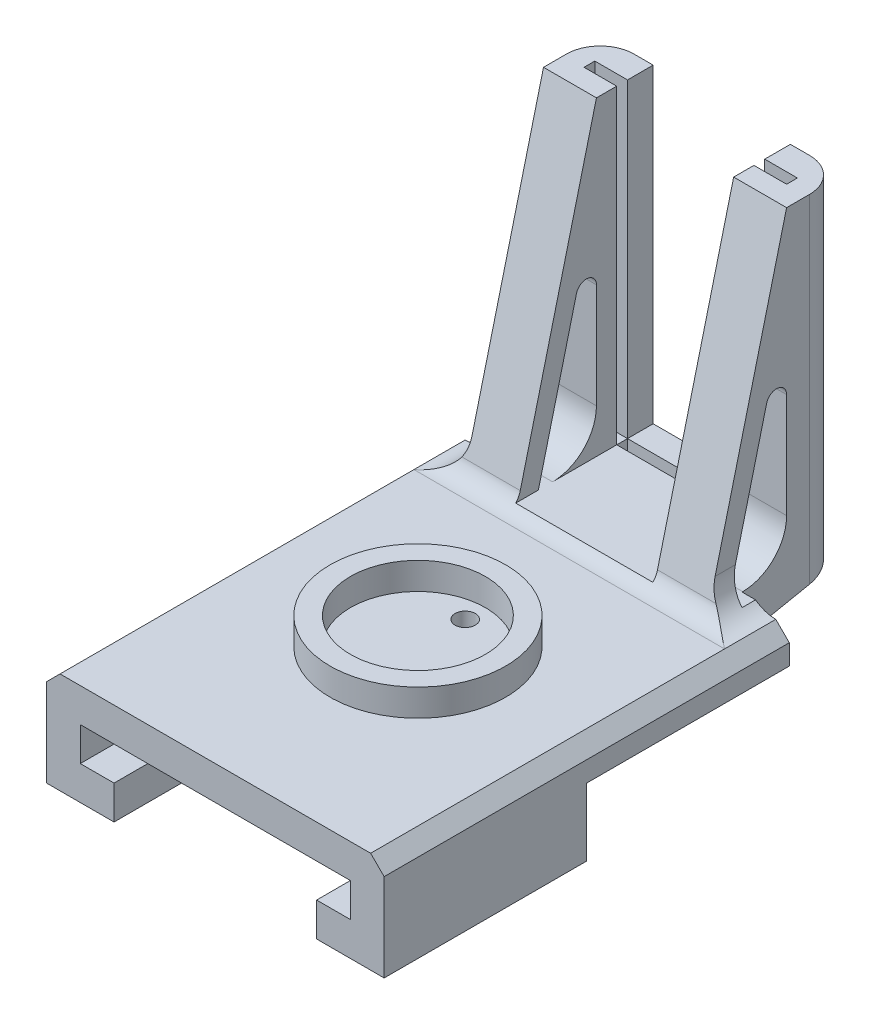
from build123d import *

# Parameters (mm, degrees)
SKETCH_2_W          = 60
SKETCH_2_H          = 60
EXTRUDE_1_DEPTH     = 3
EXTRUDE_START       = 30
EXTRUDE_3_DEPTH     = 30
EXTRUDE_START_2     = 3
SKETCH_8_W          = 36
SKETCH_8_H          = 20
EXTRUDE_4_DEPTH     = 3
CUT_EXTRUDE_START   = 6
SKETCH_10_W         = 20.32
SKETCH_10_H         = 1.6
CUT_EXTRUDE_2_DEPTH = 3
EXTRUDE_START_3     = 6
EXTRUDE_5_DEPTH     = 46
EXTRUDE_START_4     = -18
EXTRUDE_6_DEPTH     = 36
EXTRUDE_START_5     = 18
EXTRUDE_8_DEPTH     = 7.84
EXTRUDE_START_6     = -10.16
EXTRUDE_9_DEPTH     = 7.84
EXTRUDE_10_DEPTH    = 36
SKETCH_16_W         = 5
SKETCH_16_H         = 60
CUT_EXTRUDE_3_DEPTH = 3
EXTRUDE_11_DEPTH    = 4
EXTRUDE_12_DEPTH    = 4
FILLET_3_R          = 5
FILLET_4_R          = 10
SKETCH_22_W         = 50
SKETCH_22_H         = 2
EXTRUDE_14_DEPTH    = 60
CUT_EXTRUDE_START_2 = 30
CUT_EXTRUDE_4_DEPTH = 60
SKETCH_26_R         = 12.5
CUT_EXTRUDE_6_DEPTH = 2
FILLET_5_R          = 3
FILLET_7_R          = 5
FILLET_8_R          = 6.5
FILLET_9_R          = 1.5
FILLET_10_R         = 3
CUT_EXTRUDE_START_3 = 5
SKETCH_27_R         = 1.5
CUT_EXTRUDE_7_DEPTH = 3
EXTRUDE_START_7     = 5
SKETCH_28_R         = 13
SKETCH_28_R_2       = 10
EXTRUDE_15_DEPTH    = 4


with BuildPart() as part:
    # 草图2 → 凸台-拉伸1 (new body)
    with BuildSketch(Plane(origin=(0, 0, 0), x_dir=(1, 0, 0), z_dir=(0, 1, 0))):
        Rectangle(SKETCH_2_W, SKETCH_2_H)
    extrude(amount=EXTRUDE_1_DEPTH)

    # 草图7 → 凸台-拉伸3 (add)
    with BuildSketch(Plane.XY.offset(EXTRUDE_START)):
        Polygon((-25, 0), (-25, -10), (-15, -10), (-15, -5), (-20, -5), (-20, 0), align=None)
        Polygon((20, 0), (25, 0), (25, -10), (15, -10), (15, -5), (20, -5), align=None)
    extrude(amount=-EXTRUDE_3_DEPTH)

    # 草图8 → 凸台-拉伸4 (add)
    with BuildSketch(Plane(origin=(0, 0, 0), x_dir=(1, 0, 0), z_dir=(0, 1, 0)).offset(EXTRUDE_START_2)):
        with Locations((0, 35)):
            Rectangle(SKETCH_8_W, SKETCH_8_H)
    extrude(amount=EXTRUDE_4_DEPTH)

    # 草图10 → 切除-拉伸2 (cut)
    with BuildSketch(Plane(origin=(0, 0, 0), x_dir=(1, 0, 0), z_dir=(0, 1, 0)).offset(CUT_EXTRUDE_START)):
        with Locations((0, 40.4)):
            Rectangle(SKETCH_10_W, SKETCH_10_H)
    extrude(amount=-CUT_EXTRUDE_2_DEPTH, mode=Mode.SUBTRACT)

    # 草图11 → 凸台-拉伸5 (add)
    with BuildSketch(Plane(origin=(0, 0, 0), x_dir=(1, 0, 0), z_dir=(0, 1, 0)).offset(EXTRUDE_START_3)):
        Polygon((10.16, 41.2), (10.16, 45), (18, 45), (18, 36.6), (10.16, 36.6), (10.16, 39.6), (15, 39.6), (15, 41.2), align=None)
        Polygon((-15, 41.2), (-15, 39.6), (-10.16, 39.6), (-10.16, 36.6), (-18, 36.6), (-18, 45), (-10.16, 45), (-10.16, 41.2), align=None)
    extrude(amount=EXTRUDE_5_DEPTH)

    # 草图12 → 凸台-拉伸6 (add)
    with BuildSketch(Plane(origin=(0, 0, 0), x_dir=(0, 0, -1), z_dir=(1, 0, 0)).offset(EXTRUDE_START_4)):
        Polygon((30, 0), (35, 3), (30, 3), align=None)
    extrude(amount=EXTRUDE_6_DEPTH)

    # 草图13 → 凸台-拉伸8 (add)
    with BuildSketch(Plane(origin=(0, 0, 0), x_dir=(0, 0, -1), z_dir=(1, 0, 0)).offset(EXTRUDE_START_5)):
        Polygon((25, 6), (36.6, 52), (36.6, 40.103448276), (28, 6), align=None)
    extrude(amount=-EXTRUDE_8_DEPTH)

    # 草图14 → 凸台-拉伸9 (add)
    with BuildSketch(Plane(origin=(0, 0, 0), x_dir=(0, 0, -1), z_dir=(1, 0, 0)).offset(EXTRUDE_START_6)):
        Polygon((36.6, 52), (25, 6), (28, 6), (36.6, 40.103448276), align=None)
    extrude(amount=-EXTRUDE_9_DEPTH)

    # 草图15 → 凸台-拉伸10 (add)
    with BuildSketch(Plane(origin=(0, 0, 0), x_dir=(0, 0, -1), z_dir=(1, 0, 0)).offset(EXTRUDE_START_4)):
        Polygon((25, 3), (24.243478261, 3), (25, 6), align=None)
    extrude(amount=EXTRUDE_10_DEPTH)

    # 草图16 → 切除-拉伸3 (cut)
    with BuildSketch(Plane(origin=(0, 0, 0), x_dir=(1, 0, 0), z_dir=(0, 1, 0))):
        with Locations((27.5, 0)):
            Rectangle(SKETCH_16_W, SKETCH_16_H)
        with Locations((-27.5, 0)):
            Rectangle(SKETCH_16_W, SKETCH_16_H)
    extrude(amount=CUT_EXTRUDE_3_DEPTH, mode=Mode.SUBTRACT)

    # 草图17 → 凸台-拉伸11 (add)
    with BuildSketch(Plane(origin=(0, 0, 0), x_dir=(0, 0, -1), z_dir=(1, 0, 0)).offset(EXTRUDE_START_5)):
        Polygon((30, 0), (45, 3), (30, 3), align=None)
    extrude(amount=-EXTRUDE_11_DEPTH)

    # 草图18 → 凸台-拉伸12 (add)
    with BuildSketch(Plane(origin=(0, 0, 0), x_dir=(0, 0, -1), z_dir=(1, 0, 0)).offset(EXTRUDE_START_4)):
        Polygon((30, 0), (30, 3), (45, 3), align=None)
    extrude(amount=EXTRUDE_12_DEPTH)

    # 圆角3
    # the kernel refuses this fillet: 5 mm, written as the material it takes off along each edge
    with BuildSketch(Plane(origin=(18, -9.5, -45), x_dir=(0, 0, 1), z_dir=(0, 1, 0)), Plane(origin=(-18, 64.5, -45), x_dir=(0, 0, 1), z_dir=(0, -1, 0))) as fillet_3_piece_1:
        with BuildLine():
            CenterArc((FILLET_3_R, -FILLET_3_R), FILLET_3_R, 90, 90)
            Line((0, -FILLET_3_R), (0, 0))
            Line((0, 0), (FILLET_3_R, 0))
        make_face()
    extrude(amount=74, mode=Mode.SUBTRACT)

    # 圆角4
    fillet_4_edges = [part.edges().sort_by_distance(p)[0] for p in [
        (0, 3, -35),
    ]]
    fillet(fillet_4_edges, radius=FILLET_4_R)

    # 草图22 → 凸台-拉伸14 (add)
    with BuildSketch(Plane.XY.offset(EXTRUDE_START)):
        with Locations((0, 4)):
            Rectangle(SKETCH_22_W, SKETCH_22_H)
    extrude(amount=-EXTRUDE_14_DEPTH)

    # 草图24 → 切除-拉伸4 (cut)
    with BuildSketch(Plane.XY.offset(CUT_EXTRUDE_START_2)):
        Polygon((-25, 5), (-23, 5), (-25, 3), align=None)
        Polygon((25, 5), (25, 3), (23, 5), align=None)
    extrude(amount=-CUT_EXTRUDE_4_DEPTH, mode=Mode.SUBTRACT)

    # 草图26 → 切除-拉伸6 (cut)
    with BuildSketch(Plane(origin=(0, 0, 0), x_dir=(1, 0, 0), z_dir=(0, 1, 0))):
        with Locations(Location((0, 0, 0), (0, 0, 270))):
            Circle(SKETCH_26_R)
    extrude(amount=CUT_EXTRUDE_6_DEPTH, mode=Mode.SUBTRACT)

    # 圆角5
    # the kernel refuses this fillet: 3 mm, written as the material it takes off along each edge
    with BuildSketch(Plane(origin=(0, 0, 0), x_dir=(0, 0, 1), z_dir=(-1, 0, 0))) as fillet_5_piece_1:
        with BuildLine():
            CenterArc((15.328427125, 3), FILLET_5_R, 199.471220634, 70.528779366)
            Line((12.5, 2), (12.443431458, 1.98))
            ThreePointArc((12.443431458, 1.98), (12.44, 1), (12.44, 0))
            Line((12.44, 0), (12.5, -0.06))
            Line((12.5, -0.06), (15.328427125, -0.06))
            Line((15.328427125, -0.06), (15.328427125, 0))
        make_face()
    revolve(axis=Axis((0, 0, 0), (0, 1, 0)), mode=Mode.SUBTRACT)

    # 圆角7
    # the kernel refuses this fillet: 5 mm, written as the material it adds along each edge
    with BuildSketch(Plane(origin=(-18, 5, -12.247826087), x_dir=(0, 1, 0), z_dir=(0, 0, -1))) as fillet_7_piece_1_section:
        with BuildLine():
            CenterArc((FILLET_7_R, -FILLET_7_R), FILLET_7_R, 90, 90)
            Line((0, -FILLET_7_R), (0, 0))
            Line((0, 0), (FILLET_7_R, 0))
        make_face()
    fillet_7_piece_1 = extrude(amount=30.252173913, mode=Mode.PRIVATE)
    fillet_7_piece_1 = split(fillet_7_piece_1, bisect_by=Plane(origin=(-18.571810287, 7.311264389, -25.330666672), z_dir=(0, -0.24451904524274018, -0.9696444897556934)), keep=Keep.TOP, mode=Mode.PRIVATE)
    fillet_7_piece_1 = split(fillet_7_piece_1, bisect_by=Plane(origin=(-18.571810287, 6.599974755, -28.151297982), z_dir=(0, 0.24451904524274015, 0.9696444897556934)), keep=Keep.TOP, mode=Mode.PRIVATE)
    add(fillet_7_piece_1)
    with BuildSketch(Plane(origin=(-18, 5, -12.247826087), x_dir=(0, 1, 0), z_dir=(0, 0, -1))) as fillet_7_piece_2_section:
        with BuildLine():
            CenterArc((FILLET_7_R, -FILLET_7_R), FILLET_7_R, 90, 90)
            Line((0, -FILLET_7_R), (0, 0))
            Line((0, 0), (FILLET_7_R, 0))
        make_face()
    fillet_7_piece_2 = extrude(amount=17.752173913, mode=Mode.PRIVATE)
    fillet_7_piece_2 = split(fillet_7_piece_2, bisect_by=Plane(origin=(-19.572975188, 6, -28.927333211), z_dir=(0, -1, 0)), keep=Keep.TOP, mode=Mode.PRIVATE)
    fillet_7_piece_2 = split(fillet_7_piece_2, bisect_by=Plane(origin=(-19.572975188, 5.678002788, -27.918800703), z_dir=(0, -0.24451904524274015, -0.9696444897556934)), keep=Keep.TOP, mode=Mode.PRIVATE)
    add(fillet_7_piece_2)
    with BuildSketch(Plane(origin=(18, 5, -30), x_dir=(1, 0, 0), z_dir=(0, 0, 1))) as fillet_7_piece_3_section:
        with BuildLine():
            CenterArc((FILLET_7_R, FILLET_7_R), FILLET_7_R, 180, 90)
            Line((0, FILLET_7_R), (0, 0))
            Line((0, 0), (FILLET_7_R, 0))
        make_face()
    fillet_7_piece_3 = extrude(amount=17.752173913, mode=Mode.PRIVATE)
    fillet_7_piece_3 = split(fillet_7_piece_3, bisect_by=Plane(origin=(19.572975189, 6, -28.92733321), z_dir=(0, -1, 0)), keep=Keep.TOP, mode=Mode.PRIVATE)
    fillet_7_piece_3 = split(fillet_7_piece_3, bisect_by=Plane(origin=(19.572975189, 6.389292423, -25.098169394), z_dir=(0, -0.24451904524274018, -0.9696444897556934)), keep=Keep.TOP, mode=Mode.PRIVATE)
    add(fillet_7_piece_3)
    with BuildSketch(Plane(origin=(18, 5, -42.5), x_dir=(1, 0, 0), z_dir=(0, 0, 1))) as fillet_7_piece_4_section:
        with BuildLine():
            CenterArc((FILLET_7_R, FILLET_7_R), FILLET_7_R, 180, 90)
            Line((0, FILLET_7_R), (0, 0))
            Line((0, 0), (FILLET_7_R, 0))
        make_face()
    fillet_7_piece_4 = extrude(amount=30.252173913, mode=Mode.PRIVATE)
    fillet_7_piece_4 = split(fillet_7_piece_4, bisect_by=Plane(origin=(18.571810287, 7.311264389, -25.330666672), z_dir=(0, -0.24451904524274018, -0.9696444897556934)), keep=Keep.TOP, mode=Mode.PRIVATE)
    fillet_7_piece_4 = split(fillet_7_piece_4, bisect_by=Plane(origin=(18.571810287, 6.599974754, -28.151297982), z_dir=(0, 0.24451904524274015, 0.9696444897556934)), keep=Keep.TOP, mode=Mode.PRIVATE)
    add(fillet_7_piece_4)

    # 圆角8
    fillet_8_edges = [part.edges().sort_by_distance(p)[0] for p in [
        (14.08, 6, -36.6),
        (-14.08, 6, -36.6),
    ]]
    fillet(fillet_8_edges, radius=FILLET_8_R)

    # 圆角9
    fillet_9_edges = [part.edges().sort_by_distance(p)[0] for p in [
        (14.08, 40.103448276, -36.6),
        (-14.08, 40.103448276, -36.6),
    ]]
    fillet(fillet_9_edges, radius=FILLET_9_R)

    # 圆角10
    # the kernel refuses this fillet: 3 mm, written as the material it adds along each edge
    with BuildSketch(Plane(origin=(-28.843489259, 5, -24.747826087), x_dir=(-2.8138525512499648e-15, 0.9696444897556498, -0.24451904524291254), z_dir=(1, 0, 0))) as fillet_10_piece_1_section:
        with BuildLine():
            CenterArc((FILLET_10_R * 0.779131901165, FILLET_10_R), FILLET_10_R, 194.153412588, 75.846587412)
            Line((-FILLET_10_R * 0.190512588591, FILLET_10_R * 0.755480954757), (0, 0))
            Line((0, 0), (FILLET_10_R * 0.779131901165, 0))
        make_face()
    fillet_10_piece_1 = extrude(amount=57.686978517, mode=Mode.PRIVATE)
    fillet_10_piece_1 = split(fillet_10_piece_1, bisect_by=Plane(origin=(-15.866529779, 6, -24.192724601), z_dir=(0, -1, 0)), keep=Keep.TOP, mode=Mode.PRIVATE)
    fillet_10_piece_1 = fillet_10_piece_1 - Plane(origin=(-23, 10, -24.192724601), x_dir=(0, 1, 0), z_dir=(0, 0, 1)) * Cylinder(5, 125, mode=Mode.PRIVATE)
    fillet_10_piece_1 = split(fillet_10_piece_1, bisect_by=Plane(origin=(-10.16, 5.299241574, -24.192724601), z_dir=(-1, 0, 0)), keep=Keep.TOP, mode=Mode.PRIVATE)
    fillet_10_piece_1 = split(fillet_10_piece_1, bisect_by=Plane(origin=(-19.283644102, 8.716355898, -24.192724601), z_dir=(0.7071067811865488, -0.7071067811865462, 0)), keep=Keep.TOP, mode=Mode.PRIVATE)
    add(fillet_10_piece_1)
    with BuildSketch(Plane(origin=(-28.843489259, 5, -24.747826087), x_dir=(-2.8138525512499648e-15, 0.9696444897556498, -0.24451904524291254), z_dir=(1, 0, 0))) as fillet_10_piece_2_section:
        with BuildLine():
            CenterArc((FILLET_10_R * 0.779131901165, FILLET_10_R), FILLET_10_R, 194.153412588, 75.846587412)
            Line((-FILLET_10_R * 0.190512588591, FILLET_10_R * 0.755480954757), (0, 0))
            Line((0, 0), (FILLET_10_R * 0.779131901165, 0))
        make_face()
    fillet_10_piece_2 = extrude(amount=57.686978517, mode=Mode.PRIVATE)
    fillet_10_piece_2 = split(fillet_10_piece_2, bisect_by=Plane(origin=(-14.854595225, 6, -25.046116775), z_dir=(0, 1, 0)), keep=Keep.TOP, mode=Mode.PRIVATE)
    fillet_10_piece_2 = fillet_10_piece_2 - Plane(origin=(-23, 10, -25.046116775), x_dir=(0, 1, 0), z_dir=(0, 0, 1)) * Cylinder(5, 125, mode=Mode.PRIVATE)
    fillet_10_piece_2 = split(fillet_10_piece_2, bisect_by=Plane(origin=(-10.16, 6.410540932, -25.046116775), z_dir=(-1, 0, 0)), keep=Keep.TOP, mode=Mode.PRIVATE)
    fillet_10_piece_2 = split(fillet_10_piece_2, bisect_by=Plane(origin=(-18.222027147, 9.777972853, -25.046116775), z_dir=(0.7071067811865488, -0.7071067811865462, 0)), keep=Keep.TOP, mode=Mode.PRIVATE)
    add(fillet_10_piece_2)
    with BuildSketch(Plane(origin=(-28.843489259, 5, -24.747826087), x_dir=(-2.8138525512499648e-15, 0.9696444897556498, -0.24451904524291254), z_dir=(1, 0, 0))) as fillet_10_piece_3_section:
        with BuildLine():
            CenterArc((FILLET_10_R * 0.779131901165, FILLET_10_R), FILLET_10_R, 194.153412588, 75.846587412)
            Line((-FILLET_10_R * 0.190512588591, FILLET_10_R * 0.755480954757), (0, 0))
            Line((0, 0), (FILLET_10_R * 0.779131901165, 0))
        make_face()
    fillet_10_piece_3 = extrude(amount=57.686978517, mode=Mode.PRIVATE)
    fillet_10_piece_3 = split(fillet_10_piece_3, bisect_by=Plane(origin=(0, 6, -24.222418931), z_dir=(0, -1, 0)), keep=Keep.TOP, mode=Mode.PRIVATE)
    fillet_10_piece_3 = split(fillet_10_piece_3, bisect_by=Plane(origin=(-10.16, 5.321349944, -24.222418931), z_dir=(1, 0, 0)), keep=Keep.TOP, mode=Mode.PRIVATE)
    fillet_10_piece_3 = split(fillet_10_piece_3, bisect_by=Plane(origin=(10.16, 5.321349944, -24.222418931), z_dir=(-1, 0, 0)), keep=Keep.TOP, mode=Mode.PRIVATE)
    add(fillet_10_piece_3)
    with BuildSketch(Plane(origin=(-28.843489259, 5, -24.747826087), x_dir=(-2.8138525512499648e-15, 0.9696444897556498, -0.24451904524291254), z_dir=(1, 0, 0))) as fillet_10_piece_4_section:
        with BuildLine():
            CenterArc((FILLET_10_R * 0.779131901165, FILLET_10_R), FILLET_10_R, 194.153412588, 75.846587412)
            Line((-FILLET_10_R * 0.190512588591, FILLET_10_R * 0.755480954757), (0, 0))
            Line((0, 0), (FILLET_10_R * 0.779131901165, 0))
        make_face()
    fillet_10_piece_4 = extrude(amount=57.686978517, mode=Mode.PRIVATE)
    fillet_10_piece_4 = split(fillet_10_piece_4, bisect_by=Plane(origin=(15.866529778, 6, -24.192724601), z_dir=(0, -1, 0)), keep=Keep.TOP, mode=Mode.PRIVATE)
    fillet_10_piece_4 = fillet_10_piece_4 - Plane(origin=(23, 10, -24.192724601), x_dir=(1, 0, 0), z_dir=(0, 0, -1)) * Cylinder(5, 125, mode=Mode.PRIVATE)
    fillet_10_piece_4 = split(fillet_10_piece_4, bisect_by=Plane(origin=(10.16, 5.299241574, -24.192724601), z_dir=(1, 0, 0)), keep=Keep.TOP, mode=Mode.PRIVATE)
    fillet_10_piece_4 = split(fillet_10_piece_4, bisect_by=Plane(origin=(19.283644102, 8.716355898, -24.192724601), z_dir=(-0.7071067811865306, -0.7071067811865644, 0)), keep=Keep.TOP, mode=Mode.PRIVATE)
    add(fillet_10_piece_4)
    with BuildSketch(Plane(origin=(-28.843489259, 5, -24.747826087), x_dir=(-2.8138525512499648e-15, 0.9696444897556498, -0.24451904524291254), z_dir=(1, 0, 0))) as fillet_10_piece_5_section:
        with BuildLine():
            CenterArc((FILLET_10_R * 0.779131901165, FILLET_10_R), FILLET_10_R, 194.153412588, 75.846587412)
            Line((-FILLET_10_R * 0.190512588591, FILLET_10_R * 0.755480954757), (0, 0))
            Line((0, 0), (FILLET_10_R * 0.779131901165, 0))
        make_face()
    fillet_10_piece_5 = extrude(amount=57.686978517, mode=Mode.PRIVATE)
    fillet_10_piece_5 = split(fillet_10_piece_5, bisect_by=Plane(origin=(14.854595225, 6, -25.046116775), z_dir=(0, 1, 0)), keep=Keep.TOP, mode=Mode.PRIVATE)
    fillet_10_piece_5 = fillet_10_piece_5 - Plane(origin=(23, 10, -25.046116775), x_dir=(1, 0, 0), z_dir=(0, 0, -1)) * Cylinder(5, 125, mode=Mode.PRIVATE)
    fillet_10_piece_5 = split(fillet_10_piece_5, bisect_by=Plane(origin=(10.16, 6.410540932, -25.046116775), z_dir=(1, 0, 0)), keep=Keep.TOP, mode=Mode.PRIVATE)
    fillet_10_piece_5 = split(fillet_10_piece_5, bisect_by=Plane(origin=(18.222027147, 9.777972853, -25.046116775), z_dir=(-0.7071067811865306, -0.7071067811865644, 0)), keep=Keep.TOP, mode=Mode.PRIVATE)
    add(fillet_10_piece_5)

    # 草图27 → 切除-拉伸7 (cut)
    with BuildSketch(Plane(origin=(0, 0, 0), x_dir=(1, 0, 0), z_dir=(0, 1, 0)).offset(CUT_EXTRUDE_START_3)):
        with Locations(Location((0, 7, 0), (0, 0, 270))):
            Circle(SKETCH_27_R)
        with Locations(Location((0, -7, 0), (0, 0, 270))):
            Circle(SKETCH_27_R)
    extrude(amount=-CUT_EXTRUDE_7_DEPTH, mode=Mode.SUBTRACT)

    # 草图28 → 凸台-拉伸15 (add)
    with BuildSketch(Plane(origin=(0, 0, 0), x_dir=(1, 0, 0), z_dir=(0, 1, 0)).offset(EXTRUDE_START_7)):
        with Locations(Location((0, 0, 0), (0, 0, 180))):
            Circle(SKETCH_28_R)
        with Locations(Location((0, 0, 0), (0, 0, 180))):
            Circle(SKETCH_28_R_2, mode=Mode.SUBTRACT)
    extrude(amount=EXTRUDE_15_DEPTH)


solid = part.part
